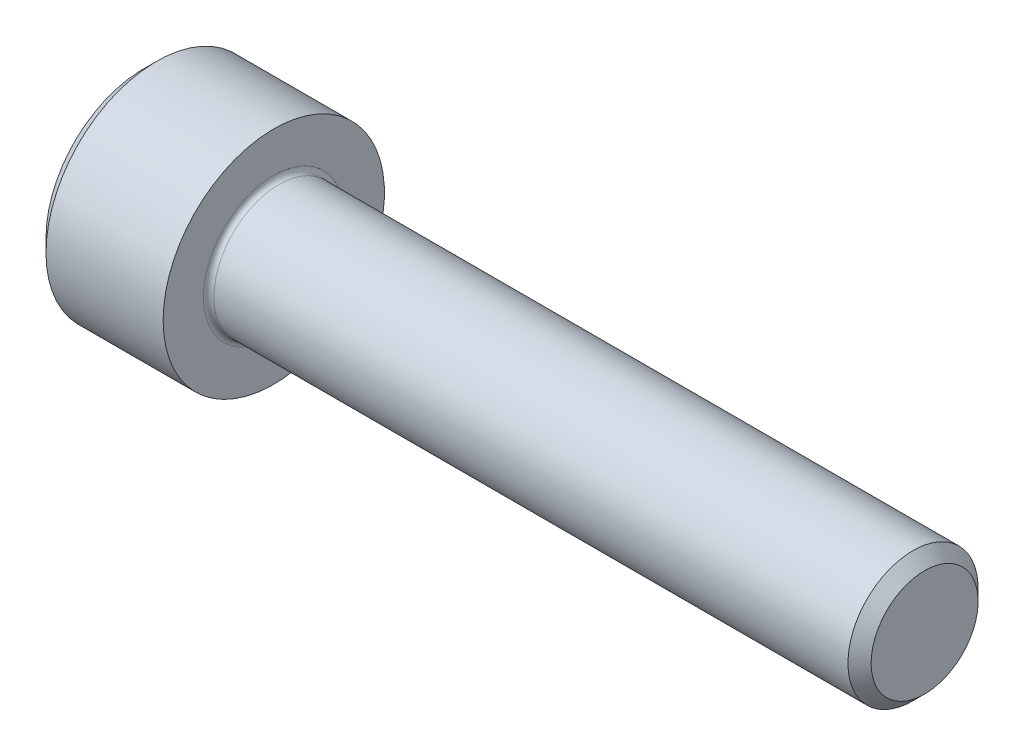
from build123d import *

# Parameters (mm, degrees)
FILLET1_R = 0.2


with BuildPart() as part:
    # BodySke → Base-Revolve (revolve)
    with BuildSketch(Plane.XY):
        Polygon((0, 0), (0, 3.75), (0.5, 4.25), (5, 4.25), (5, 2.5), (29.555, 2.5), (30, 2.055), (30, 0), align=None)
    revolve(axis=Axis((-31.75, 0, 0), (1, 0, 0)))

    # Fillet1
    fillet1_edges = [part.edges().sort_by_distance(p)[0] for p in [
        (5, -2.5, 0),
    ]]
    fillet(fillet1_edges, radius=FILLET1_R)


solid = part.part
